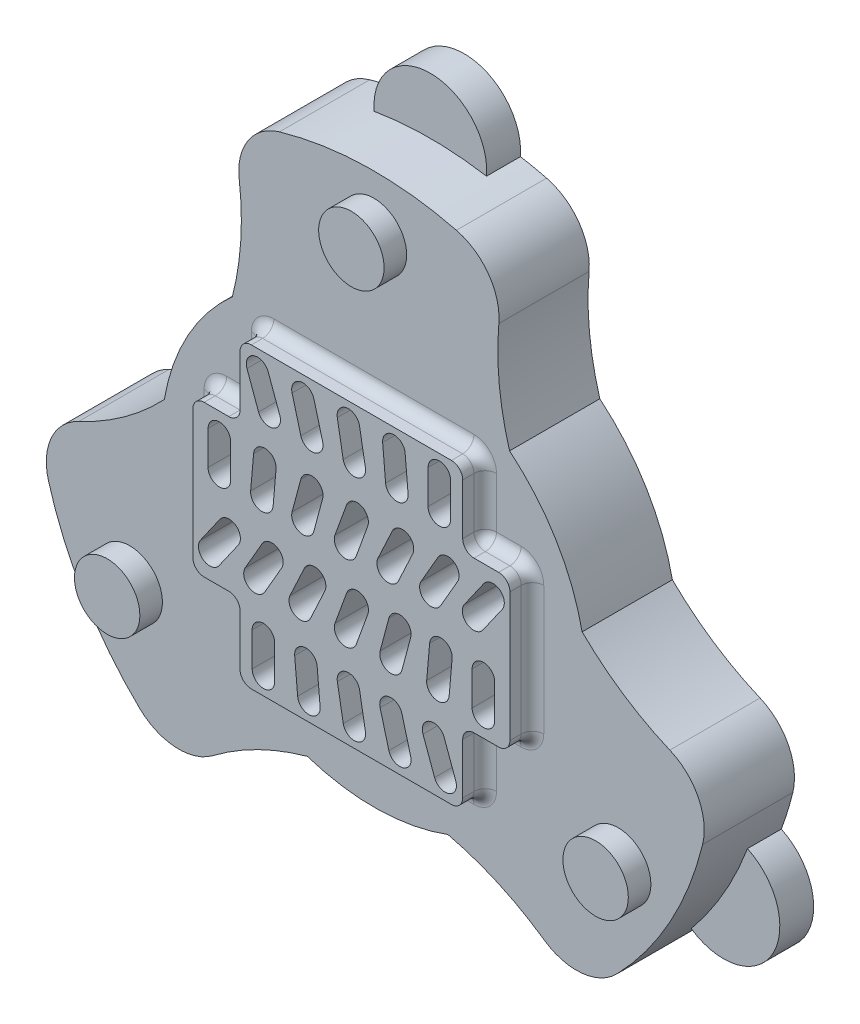
from build123d import *

# Parameters (mm, degrees)
SKETCH2_R           = 18.85
BOSS_EXTRUDE1_DEPTH = 8
SKETCH3_R           = 30
SKETCH3_R_2         = 17.600030795
BOSS_EXTRUDE2_DEPTH = 8
SKETCH4_R           = 2.9
BOSS_EXTRUDE3_DEPTH = 2
SKETCH6_R           = 5
BOSS_EXTRUDE4_DEPTH = 3
SKETCH5_R           = 3
CUT_EXTRUDE1_DEPTH  = 3
SKETCH7_R           = 25
CUT_EXTRUDE2_DEPTH  = 8
FILLET1_R           = 5
SKETCH2_2_R         = 18.85
BOSS_EXTRUDE5_DEPTH = 10
CUT_EXTRUDE3_START  = -2
SKETCH10_R          = 18.85
CUT_EXTRUDE3_DEPTH  = 2
FILLET2_R           = 1
FILLET3_R           = 1


with BuildPart() as part:
    # Sketch2 → Boss-Extrude1 (new body)
    with BuildSketch(Plane.XY.offset(10)):
        Circle(SKETCH2_R)
        with BuildLine():
            Line((4.764111012, 11.713944834), (5.02557824, 8.72536074))
            ThreePointArc((5.02557824, 8.72536074), (4.116539285, 7.642010299), (3.033188844, 8.551049254))
            Line((3.033188844, 8.551049254), (2.771721616, 11.539633349))
            ThreePointArc((2.771721616, 11.539633349), (3.680760571, 12.62298379), (4.764111012, 11.713944834))
        make_face(mode=Mode.SUBTRACT)
        with BuildLine():
            Line((0.721986022, 11.783756617), (1.242930555, 8.829333358))
            ThreePointArc((1.242930555, 8.829333358), (0.431770979, 7.670877427), (-0.726684951, 8.482037002))
            Line((-0.726684951, 8.482037002), (-1.247629484, 11.436460261))
            ThreePointArc((-1.247629484, 11.436460261), (-0.436469909, 12.594916192), (0.721986022, 11.783756617))
        make_face(mode=Mode.SUBTRACT)
        with BuildLine():
            Line((-3.324652206, 11.840604594), (-2.548195071, 8.942827115))
            ThreePointArc((-2.548195071, 8.942827115), (-3.255301852, 7.718082244), (-4.480046723, 8.425189025))
            Line((-4.480046723, 8.425189025), (-5.256503859, 11.322966504))
            ThreePointArc((-5.256503859, 11.322966504), (-4.549397078, 12.547711375), (-3.324652206, 11.840604594))
        make_face(mode=Mode.SUBTRACT)
        with BuildLine():
            Line((-7.374687666, 11.884056119), (-6.348627236, 9.064978256))
            ThreePointArc((-6.348627236, 9.064978256), (-6.946299713, 7.783265492), (-8.228012478, 8.38093797))
            Line((-8.228012478, 8.38093797), (-9.254072908, 11.200015832))
            ThreePointArc((-9.254072908, 11.200015832), (-8.65640043, 12.481728596), (-7.374687666, 11.884056119))
        make_face(mode=Mode.SUBTRACT)
        with BuildLine():
            Line((10.016532673, 2.722847178), (11.737262197, 5.180303618))
            ThreePointArc((11.737262197, 5.180303618), (13.129990678, 5.425879226), (13.375566285, 4.033150745))
            Line((13.375566285, 4.033150745), (11.654836761, 1.575694305))
            ThreePointArc((11.654836761, 1.575694305), (10.262108281, 1.330118697), (10.016532673, 2.722847178))
        make_face(mode=Mode.SUBTRACT)
        with BuildLine():
            Line((6.180023981, 2.578960693), (7.680024169, 5.17703723))
            ThreePointArc((7.680024169, 5.17703723), (9.046049573, 5.543062633), (9.412074977, 4.17703723))
            Line((9.412074977, 4.17703723), (7.912074789, 1.578960693))
            ThreePointArc((7.912074789, 1.578960693), (6.546049385, 1.212935289), (6.180023981, 2.578960693))
        make_face(mode=Mode.SUBTRACT)
        with BuildLine():
            Line((2.35581422, 2.441155373), (3.623669164, 5.160079074))
            ThreePointArc((3.623669164, 5.160079074), (4.952595213, 5.643768599), (5.436284738, 4.31484255))
            Line((5.436284738, 4.31484255), (4.168429794, 1.595918849))
            ThreePointArc((4.168429794, 1.595918849), (2.839503745, 1.112229324), (2.35581422, 2.441155373))
        make_face(mode=Mode.SUBTRACT)
        with BuildLine():
            Line((-1.456673421, 2.310479997), (-0.430612863, 5.129558212))
            ThreePointArc((-0.430612863, 5.129558212), (0.851099902, 5.72723069), (1.448772379, 4.445517926))
            Line((1.448772379, 4.445517926), (0.422711821, 1.626439711))
            ThreePointArc((0.422711821, 1.626439711), (-0.859000943, 1.028767233), (-1.456673421, 2.310479997))
        make_face(mode=Mode.SUBTRACT)
        with BuildLine():
            Line((-5.258104963, 2.187929086), (-4.481647731, 5.085706927))
            ThreePointArc((-4.481647731, 5.085706927), (-3.25690286, 5.792813708), (-2.549796078, 4.568068837))
            Line((-2.549796078, 4.568068837), (-3.326253311, 1.670290996))
            ThreePointArc((-3.326253311, 1.670290996), (-4.550998182, 0.963184214), (-5.258104963, 2.187929086))
        make_face(mode=Mode.SUBTRACT)
        with BuildLine():
            Line((-8.92962778, 1.970363305), (-8.668160552, 4.958947399))
            ThreePointArc((-8.668160552, 4.958947399), (-7.584810111, 5.867986354), (-6.675771155, 4.784635913))
            Line((-6.675771155, 4.784635913), (-6.937238384, 1.796051819))
            ThreePointArc((-6.937238384, 1.796051819), (-8.020588824, 0.887012864), (-8.92962778, 1.970363305))
        make_face(mode=Mode.SUBTRACT)
        with BuildLine():
            Line((-12.703950937, 1.877998774), (-12.703950937, 4.877999149))
            ThreePointArc((-12.703950937, 4.877999149), (-11.703950937, 5.877999149), (-10.703950937, 4.877999149))
            Line((-10.703950937, 4.877999149), (-10.703950937, 1.877998774))
            ThreePointArc((-10.703950937, 1.877998774), (-11.703950937, 0.877998774), (-12.703950937, 1.877998774))
        make_face(mode=Mode.SUBTRACT)
        with BuildLine():
            Line((8.797649477, 11.632897752), (8.797649477, 8.632897752))
            ThreePointArc((8.797649477, 8.632897752), (7.797649477, 7.632897752), (6.797649477, 8.632897752))
            Line((6.797649477, 8.632897752), (6.797649477, 11.632897752))
            ThreePointArc((6.797649477, 11.632897752), (7.797649477, 12.632897752), (8.797649477, 11.632897752))
        make_face(mode=Mode.SUBTRACT)
        with BuildLine():
            Line((-4.764111012, -11.713944834), (-5.02557824, -8.72536074))
            ThreePointArc((-5.02557824, -8.72536074), (-4.116539285, -7.642010299), (-3.033188844, -8.551049254))
            Line((-3.033188844, -8.551049254), (-2.771721616, -11.539633349))
            ThreePointArc((-2.771721616, -11.539633349), (-3.680760571, -12.62298379), (-4.764111012, -11.713944834))
        make_face(mode=Mode.SUBTRACT)
        with BuildLine():
            Line((-0.721986022, -11.783756617), (-1.242930555, -8.829333358))
            ThreePointArc((-1.242930555, -8.829333358), (-0.431770979, -7.670877427), (0.726684951, -8.482037002))
            Line((0.726684951, -8.482037002), (1.247629484, -11.436460261))
            ThreePointArc((1.247629484, -11.436460261), (0.436469909, -12.594916192), (-0.721986022, -11.783756617))
        make_face(mode=Mode.SUBTRACT)
        with BuildLine():
            Line((3.324652206, -11.840604594), (2.548195071, -8.942827115))
            ThreePointArc((2.548195071, -8.942827115), (3.255301852, -7.718082244), (4.480046723, -8.425189025))
            Line((4.480046723, -8.425189025), (5.256503859, -11.322966504))
            ThreePointArc((5.256503859, -11.322966504), (4.549397078, -12.547711375), (3.324652206, -11.840604594))
        make_face(mode=Mode.SUBTRACT)
        with BuildLine():
            Line((7.374687666, -11.884056119), (6.348627236, -9.064978256))
            ThreePointArc((6.348627236, -9.064978256), (6.946299713, -7.783265492), (8.228012478, -8.38093797))
            Line((8.228012478, -8.38093797), (9.254072908, -11.200015832))
            ThreePointArc((9.254072908, -11.200015832), (8.65640043, -12.481728596), (7.374687666, -11.884056119))
        make_face(mode=Mode.SUBTRACT)
        with BuildLine():
            Line((-10.016532673, -2.722847178), (-11.737262197, -5.180303618))
            ThreePointArc((-11.737262197, -5.180303618), (-13.129990678, -5.425879226), (-13.375566285, -4.033150745))
            Line((-13.375566285, -4.033150745), (-11.654836761, -1.575694305))
            ThreePointArc((-11.654836761, -1.575694305), (-10.262108281, -1.330118697), (-10.016532673, -2.722847178))
        make_face(mode=Mode.SUBTRACT)
        with BuildLine():
            Line((-6.180023981, -2.578960693), (-7.680024169, -5.17703723))
            ThreePointArc((-7.680024169, -5.17703723), (-9.046049573, -5.543062633), (-9.412074977, -4.17703723))
            Line((-9.412074977, -4.17703723), (-7.912074789, -1.578960693))
            ThreePointArc((-7.912074789, -1.578960693), (-6.546049385, -1.212935289), (-6.180023981, -2.578960693))
        make_face(mode=Mode.SUBTRACT)
        with BuildLine():
            Line((-2.35581422, -2.441155373), (-3.623669164, -5.160079074))
            ThreePointArc((-3.623669164, -5.160079074), (-4.952595213, -5.643768599), (-5.436284738, -4.31484255))
            Line((-5.436284738, -4.31484255), (-4.168429794, -1.595918849))
            ThreePointArc((-4.168429794, -1.595918849), (-2.839503745, -1.112229324), (-2.35581422, -2.441155373))
        make_face(mode=Mode.SUBTRACT)
        with BuildLine():
            Line((1.456673421, -2.310479997), (0.430612863, -5.129558212))
            ThreePointArc((0.430612863, -5.129558212), (-0.851099902, -5.72723069), (-1.448772379, -4.445517926))
            Line((-1.448772379, -4.445517926), (-0.422711821, -1.626439711))
            ThreePointArc((-0.422711821, -1.626439711), (0.859000943, -1.028767233), (1.456673421, -2.310479997))
        make_face(mode=Mode.SUBTRACT)
        with BuildLine():
            Line((5.258104963, -2.187929086), (4.481647731, -5.085706927))
            ThreePointArc((4.481647731, -5.085706927), (3.25690286, -5.792813708), (2.549796078, -4.568068837))
            Line((2.549796078, -4.568068837), (3.326253311, -1.670290996))
            ThreePointArc((3.326253311, -1.670290996), (4.550998182, -0.963184214), (5.258104963, -2.187929086))
        make_face(mode=Mode.SUBTRACT)
        with BuildLine():
            Line((8.92962778, -1.970363305), (8.668160552, -4.958947399))
            ThreePointArc((8.668160552, -4.958947399), (7.584810111, -5.867986354), (6.675771155, -4.784635913))
            Line((6.675771155, -4.784635913), (6.937238384, -1.796051819))
            ThreePointArc((6.937238384, -1.796051819), (8.020588824, -0.887012864), (8.92962778, -1.970363305))
        make_face(mode=Mode.SUBTRACT)
        with BuildLine():
            Line((12.703950937, -1.877998774), (12.703950937, -4.877999149))
            ThreePointArc((12.703950937, -4.877999149), (11.703950937, -5.877999149), (10.703950937, -4.877999149))
            Line((10.703950937, -4.877999149), (10.703950937, -1.877998774))
            ThreePointArc((10.703950937, -1.877998774), (11.703950937, -0.877998774), (12.703950937, -1.877998774))
        make_face(mode=Mode.SUBTRACT)
        with BuildLine():
            Line((-8.797649477, -11.632897752), (-8.797649477, -8.632897752))
            ThreePointArc((-8.797649477, -8.632897752), (-7.797649477, -7.632897752), (-6.797649477, -8.632897752))
            Line((-6.797649477, -8.632897752), (-6.797649477, -11.632897752))
            ThreePointArc((-6.797649477, -11.632897752), (-7.797649477, -12.632897752), (-8.797649477, -11.632897752))
        make_face(mode=Mode.SUBTRACT)
    extrude(amount=BOSS_EXTRUDE1_DEPTH)

    # Sketch3 → Boss-Extrude2 (add)
    with BuildSketch(Plane.XY.offset(18)):
        Circle(SKETCH3_R)
        Circle(SKETCH3_R_2, mode=Mode.SUBTRACT)
    extrude(amount=-BOSS_EXTRUDE2_DEPTH)

    # Sketch4 → Boss-Extrude3 (add)
    with BuildSketch(Plane.XY.offset(18)):
        with Locations((0, 25)):
            Circle(SKETCH4_R)
        with Locations((21.650635095, -12.5)):
            Circle(SKETCH4_R)
        with Locations((-21.650635095, -12.5)):
            Circle(SKETCH4_R)
    extrude(amount=BOSS_EXTRUDE3_DEPTH)

    # Sketch6 → Boss-Extrude4 (add)
    with BuildSketch(Plane(origin=(0, 0, 10), x_dir=(-1, 0, 0), z_dir=(0, 0, -1))):
        with Locations((0, 30)):
            Circle(SKETCH6_R)
        with Locations((25.980762114, -15)):
            Circle(SKETCH6_R)
        with Locations((-25.980762114, -15)):
            Circle(SKETCH6_R)
    extrude(amount=-BOSS_EXTRUDE4_DEPTH)

    # Sketch5 → Cut-Extrude1 (cut)
    with BuildSketch(Plane(origin=(0, 0, 10), x_dir=(-1, 0, 0), z_dir=(0, 0, -1))):
        with Locations((0, 25)):
            Circle(SKETCH5_R)
        with Locations((21.650635095, -12.5)):
            Circle(SKETCH5_R)
        with Locations((-21.650635095, -12.5)):
            Circle(SKETCH5_R)
    extrude(amount=-CUT_EXTRUDE1_DEPTH, mode=Mode.SUBTRACT)

    # Sketch7 → Cut-Extrude2 (cut)
    with BuildSketch(Plane(origin=(0, 0, 10), x_dir=(-1, 0, 0), z_dir=(0, 0, -1))):
        with Locations((-35.980083702, 21.666415873)):
            Circle(SKETCH7_R)
        with Locations((36.753708406, 20.32645858)):
            Circle(SKETCH7_R)
        with Locations((-0.773624703, -41.992874453)):
            Circle(SKETCH7_R)
    extrude(amount=-CUT_EXTRUDE2_DEPTH, mode=Mode.SUBTRACT)

    # Fillet1
    fillet1_edges = [part.edges().sort_by_distance(p)[0] for p in [
        (29.888839754, -2.580166302, 14),
        (11.700383981, 27.624283062, 14),
        (-12.709930313, 27.174577668, 14),
        (-29.773522884, -3.679311769, 14),
        (-17.178909441, -24.594411366, 14),
        (18.073138902, -23.944971293, 14),
    ]]
    fillet(fillet1_edges, radius=FILLET1_R)

    # Sketch2<2> → Boss-Extrude5 (add)
    with BuildSketch(Plane.XY.offset(10)):
        with Locations(Location((0, 0, 0), (0, 0, 170.365488853))):
            Circle(SKETCH2_2_R)
        with BuildLine():
            Line((4.764111012, 11.713944834), (5.02557824, 8.72536074))
            ThreePointArc((5.02557824, 8.72536074), (4.116539285, 7.642010299), (3.033188844, 8.551049254))
            Line((3.033188844, 8.551049254), (2.771721616, 11.539633349))
            ThreePointArc((2.771721616, 11.539633349), (3.680760571, 12.62298379), (4.764111012, 11.713944834))
        make_face(mode=Mode.SUBTRACT)
        with BuildLine():
            Line((0.721986022, 11.783756617), (1.242930555, 8.829333358))
            ThreePointArc((1.242930555, 8.829333358), (0.431770979, 7.670877427), (-0.726684951, 8.482037002))
            Line((-0.726684951, 8.482037002), (-1.247629484, 11.436460261))
            ThreePointArc((-1.247629484, 11.436460261), (-0.436469909, 12.594916192), (0.721986022, 11.783756617))
        make_face(mode=Mode.SUBTRACT)
        with BuildLine():
            Line((-3.324652206, 11.840604594), (-2.548195071, 8.942827115))
            ThreePointArc((-2.548195071, 8.942827115), (-3.255301852, 7.718082244), (-4.480046723, 8.425189025))
            Line((-4.480046723, 8.425189025), (-5.256503859, 11.322966504))
            ThreePointArc((-5.256503859, 11.322966504), (-4.549397078, 12.547711375), (-3.324652206, 11.840604594))
        make_face(mode=Mode.SUBTRACT)
        with BuildLine():
            Line((-7.374687666, 11.884056119), (-6.348627236, 9.064978256))
            ThreePointArc((-6.348627236, 9.064978256), (-6.946299713, 7.783265492), (-8.228012478, 8.38093797))
            Line((-8.228012478, 8.38093797), (-9.254072908, 11.200015832))
            ThreePointArc((-9.254072908, 11.200015832), (-8.65640043, 12.481728596), (-7.374687666, 11.884056119))
        make_face(mode=Mode.SUBTRACT)
        with BuildLine():
            Line((10.016532673, 2.722847178), (11.737262197, 5.180303618))
            ThreePointArc((11.737262197, 5.180303618), (13.129990678, 5.425879226), (13.375566285, 4.033150745))
            Line((13.375566285, 4.033150745), (11.654836761, 1.575694305))
            ThreePointArc((11.654836761, 1.575694305), (10.262108281, 1.330118697), (10.016532673, 2.722847178))
        make_face(mode=Mode.SUBTRACT)
        with BuildLine():
            Line((6.180023981, 2.578960693), (7.680024169, 5.17703723))
            ThreePointArc((7.680024169, 5.17703723), (9.046049573, 5.543062633), (9.412074977, 4.17703723))
            Line((9.412074977, 4.17703723), (7.912074789, 1.578960693))
            ThreePointArc((7.912074789, 1.578960693), (6.546049385, 1.212935289), (6.180023981, 2.578960693))
        make_face(mode=Mode.SUBTRACT)
        with BuildLine():
            Line((2.35581422, 2.441155373), (3.623669164, 5.160079074))
            ThreePointArc((3.623669164, 5.160079074), (4.952595213, 5.643768599), (5.436284738, 4.31484255))
            Line((5.436284738, 4.31484255), (4.168429794, 1.595918849))
            ThreePointArc((4.168429794, 1.595918849), (2.839503745, 1.112229324), (2.35581422, 2.441155373))
        make_face(mode=Mode.SUBTRACT)
        with BuildLine():
            Line((-1.456673421, 2.310479997), (-0.430612863, 5.129558212))
            ThreePointArc((-0.430612863, 5.129558212), (0.851099902, 5.72723069), (1.448772379, 4.445517926))
            Line((1.448772379, 4.445517926), (0.422711821, 1.626439711))
            ThreePointArc((0.422711821, 1.626439711), (-0.859000943, 1.028767233), (-1.456673421, 2.310479997))
        make_face(mode=Mode.SUBTRACT)
        with BuildLine():
            Line((-5.258104963, 2.187929086), (-4.481647731, 5.085706927))
            ThreePointArc((-4.481647731, 5.085706927), (-3.25690286, 5.792813708), (-2.549796078, 4.568068837))
            Line((-2.549796078, 4.568068837), (-3.326253311, 1.670290996))
            ThreePointArc((-3.326253311, 1.670290996), (-4.550998182, 0.963184214), (-5.258104963, 2.187929086))
        make_face(mode=Mode.SUBTRACT)
        with BuildLine():
            Line((-8.92962778, 1.970363305), (-8.668160552, 4.958947399))
            ThreePointArc((-8.668160552, 4.958947399), (-7.584810111, 5.867986354), (-6.675771155, 4.784635913))
            Line((-6.675771155, 4.784635913), (-6.937238384, 1.796051819))
            ThreePointArc((-6.937238384, 1.796051819), (-8.020588824, 0.887012864), (-8.92962778, 1.970363305))
        make_face(mode=Mode.SUBTRACT)
        with BuildLine():
            Line((-12.703950937, 1.877998774), (-12.703950937, 4.877999149))
            ThreePointArc((-12.703950937, 4.877999149), (-11.703950937, 5.877999149), (-10.703950937, 4.877999149))
            Line((-10.703950937, 4.877999149), (-10.703950937, 1.877998774))
            ThreePointArc((-10.703950937, 1.877998774), (-11.703950937, 0.877998774), (-12.703950937, 1.877998774))
        make_face(mode=Mode.SUBTRACT)
        with BuildLine():
            Line((8.797649477, 11.632897752), (8.797649477, 8.632897752))
            ThreePointArc((8.797649477, 8.632897752), (7.797649477, 7.632897752), (6.797649477, 8.632897752))
            Line((6.797649477, 8.632897752), (6.797649477, 11.632897752))
            ThreePointArc((6.797649477, 11.632897752), (7.797649477, 12.632897752), (8.797649477, 11.632897752))
        make_face(mode=Mode.SUBTRACT)
        with BuildLine():
            Line((-4.764111012, -11.713944834), (-5.02557824, -8.72536074))
            ThreePointArc((-5.02557824, -8.72536074), (-4.116539285, -7.642010299), (-3.033188844, -8.551049254))
            Line((-3.033188844, -8.551049254), (-2.771721616, -11.539633349))
            ThreePointArc((-2.771721616, -11.539633349), (-3.680760571, -12.62298379), (-4.764111012, -11.713944834))
        make_face(mode=Mode.SUBTRACT)
        with BuildLine():
            Line((-0.721986022, -11.783756617), (-1.242930555, -8.829333358))
            ThreePointArc((-1.242930555, -8.829333358), (-0.431770979, -7.670877427), (0.726684951, -8.482037002))
            Line((0.726684951, -8.482037002), (1.247629484, -11.436460261))
            ThreePointArc((1.247629484, -11.436460261), (0.436469909, -12.594916192), (-0.721986022, -11.783756617))
        make_face(mode=Mode.SUBTRACT)
        with BuildLine():
            Line((3.324652206, -11.840604594), (2.548195071, -8.942827115))
            ThreePointArc((2.548195071, -8.942827115), (3.255301852, -7.718082244), (4.480046723, -8.425189025))
            Line((4.480046723, -8.425189025), (5.256503859, -11.322966504))
            ThreePointArc((5.256503859, -11.322966504), (4.549397078, -12.547711375), (3.324652206, -11.840604594))
        make_face(mode=Mode.SUBTRACT)
        with BuildLine():
            Line((7.374687666, -11.884056119), (6.348627236, -9.064978256))
            ThreePointArc((6.348627236, -9.064978256), (6.946299713, -7.783265492), (8.228012478, -8.38093797))
            Line((8.228012478, -8.38093797), (9.254072908, -11.200015832))
            ThreePointArc((9.254072908, -11.200015832), (8.65640043, -12.481728596), (7.374687666, -11.884056119))
        make_face(mode=Mode.SUBTRACT)
        with BuildLine():
            Line((-10.016532673, -2.722847178), (-11.737262197, -5.180303618))
            ThreePointArc((-11.737262197, -5.180303618), (-13.129990678, -5.425879226), (-13.375566285, -4.033150745))
            Line((-13.375566285, -4.033150745), (-11.654836761, -1.575694305))
            ThreePointArc((-11.654836761, -1.575694305), (-10.262108281, -1.330118697), (-10.016532673, -2.722847178))
        make_face(mode=Mode.SUBTRACT)
        with BuildLine():
            Line((-6.180023981, -2.578960693), (-7.680024169, -5.17703723))
            ThreePointArc((-7.680024169, -5.17703723), (-9.046049573, -5.543062633), (-9.412074977, -4.17703723))
            Line((-9.412074977, -4.17703723), (-7.912074789, -1.578960693))
            ThreePointArc((-7.912074789, -1.578960693), (-6.546049385, -1.212935289), (-6.180023981, -2.578960693))
        make_face(mode=Mode.SUBTRACT)
        with BuildLine():
            Line((-2.35581422, -2.441155373), (-3.623669164, -5.160079074))
            ThreePointArc((-3.623669164, -5.160079074), (-4.952595213, -5.643768599), (-5.436284738, -4.31484255))
            Line((-5.436284738, -4.31484255), (-4.168429794, -1.595918849))
            ThreePointArc((-4.168429794, -1.595918849), (-2.839503745, -1.112229324), (-2.35581422, -2.441155373))
        make_face(mode=Mode.SUBTRACT)
        with BuildLine():
            Line((1.456673421, -2.310479997), (0.430612863, -5.129558212))
            ThreePointArc((0.430612863, -5.129558212), (-0.851099902, -5.72723069), (-1.448772379, -4.445517926))
            Line((-1.448772379, -4.445517926), (-0.422711821, -1.626439711))
            ThreePointArc((-0.422711821, -1.626439711), (0.859000943, -1.028767233), (1.456673421, -2.310479997))
        make_face(mode=Mode.SUBTRACT)
        with BuildLine():
            Line((5.258104963, -2.187929086), (4.481647731, -5.085706927))
            ThreePointArc((4.481647731, -5.085706927), (3.25690286, -5.792813708), (2.549796078, -4.568068837))
            Line((2.549796078, -4.568068837), (3.326253311, -1.670290996))
            ThreePointArc((3.326253311, -1.670290996), (4.550998182, -0.963184214), (5.258104963, -2.187929086))
        make_face(mode=Mode.SUBTRACT)
        with BuildLine():
            Line((8.92962778, -1.970363305), (8.668160552, -4.958947399))
            ThreePointArc((8.668160552, -4.958947399), (7.584810111, -5.867986354), (6.675771155, -4.784635913))
            Line((6.675771155, -4.784635913), (6.937238384, -1.796051819))
            ThreePointArc((6.937238384, -1.796051819), (8.020588824, -0.887012864), (8.92962778, -1.970363305))
        make_face(mode=Mode.SUBTRACT)
        with BuildLine():
            Line((12.703950937, -1.877998774), (12.703950937, -4.877999149))
            ThreePointArc((12.703950937, -4.877999149), (11.703950937, -5.877999149), (10.703950937, -4.877999149))
            Line((10.703950937, -4.877999149), (10.703950937, -1.877998774))
            ThreePointArc((10.703950937, -1.877998774), (11.703950937, -0.877998774), (12.703950937, -1.877998774))
        make_face(mode=Mode.SUBTRACT)
        with BuildLine():
            Line((-8.797649477, -11.632897752), (-8.797649477, -8.632897752))
            ThreePointArc((-8.797649477, -8.632897752), (-7.797649477, -7.632897752), (-6.797649477, -8.632897752))
            Line((-6.797649477, -8.632897752), (-6.797649477, -11.632897752))
            ThreePointArc((-6.797649477, -11.632897752), (-7.797649477, -12.632897752), (-8.797649477, -11.632897752))
        make_face(mode=Mode.SUBTRACT)
    extrude(amount=BOSS_EXTRUDE5_DEPTH)

    # Sketch10 → Cut-Extrude3 (cut)
    with BuildSketch(Plane.XY.offset(20).offset(CUT_EXTRUDE3_START)):
        Circle(SKETCH10_R)
        Polygon((-9.868323971, 6.706489919), (-9.868323971, 13.206875856), (9.868323971, 13.206875856), (9.868323971, 6.706489919), (14.053503957, 6.706489919), (14.053503957, -6.706489919), (9.868323971, -6.706489919), (9.868323971, -13.206875856), (-9.868323971, -13.206875856), (-9.868323971, -6.706489919), (-14.053503957, -6.706489919), (-14.053503957, 6.706489919), align=None, mode=Mode.SUBTRACT)
    extrude(amount=CUT_EXTRUDE3_DEPTH, mode=Mode.SUBTRACT)

    # Fillet2
    fillet2_edges = [part.edges().sort_by_distance(p)[0] for p in [
        (-9.868323971, 9.956682888, 18),
        (-14.053503957, 0, 18),
        (-11.960913964, -6.706489919, 18),
        (-9.868323971, -9.956682888, 18),
        (0, -13.206875856, 18),
        (11.960913964, -6.706489919, 18),
        (11.960913964, 6.706489919, 18),
        (14.053503957, 6.706489919, 19),
        (9.868323971, 9.956682888, 18),
        (0, 13.206875856, 18),
        (9.868323971, 13.206875856, 19),
        (-9.868323971, 13.206875856, 19),
        (-11.960913964, 6.706489919, 18),
        (-9.868323971, 6.706489919, 19),
        (-14.053503957, 6.706489919, 19),
        (-14.053503957, -6.706489919, 19),
        (-9.868323971, -6.706489919, 19),
        (-9.868323971, -13.206875856, 19),
        (9.868323971, -9.956682888, 18),
        (9.868323971, -13.206875856, 19),
        (9.868323971, -6.706489919, 19),
        (14.053503957, 0, 18),
        (14.053503957, -6.706489919, 19),
    ]]
    fillet(fillet2_edges, radius=FILLET2_R)

    # Fillet3
    # the kernel refuses this fillet: 1 mm, written as the material it adds along each edge
    with BuildSketch(Plane(origin=(10.868323971, 7.706489919, 19), x_dir=(0, -1, 0), z_dir=(-1, 0, 0))) as fillet3_piece_1_section:
        Polygon((0, 0), (FILLET3_R, 0), (FILLET3_R, -FILLET3_R), (0, -FILLET3_R), align=None)
    fillet3_piece_1 = extrude(amount=FILLET3_R, mode=Mode.PRIVATE)
    fillet3_piece_1 = fillet3_piece_1 - Plane(origin=(10.868323971, 7.706489919, 19), x_dir=(0, 0.7071067811865475, 0.7071067811865475), z_dir=(-1, 0, 0)) * Sphere(FILLET3_R, mode=Mode.PRIVATE)
    add(fillet3_piece_1)
    with BuildSketch(Plane(origin=(9.868323971, 6.706489919, 19), x_dir=(0, 1, 0), z_dir=(0, 0, 1))) as fillet3_piece_2:
        with BuildLine():
            CenterArc((FILLET3_R, -FILLET3_R), FILLET3_R, 90, 90)
            Line((0, -FILLET3_R), (0, 0))
            Line((0, 0), (FILLET3_R, 0))
        make_face()
    extrude(amount=1)


solid = part.part
